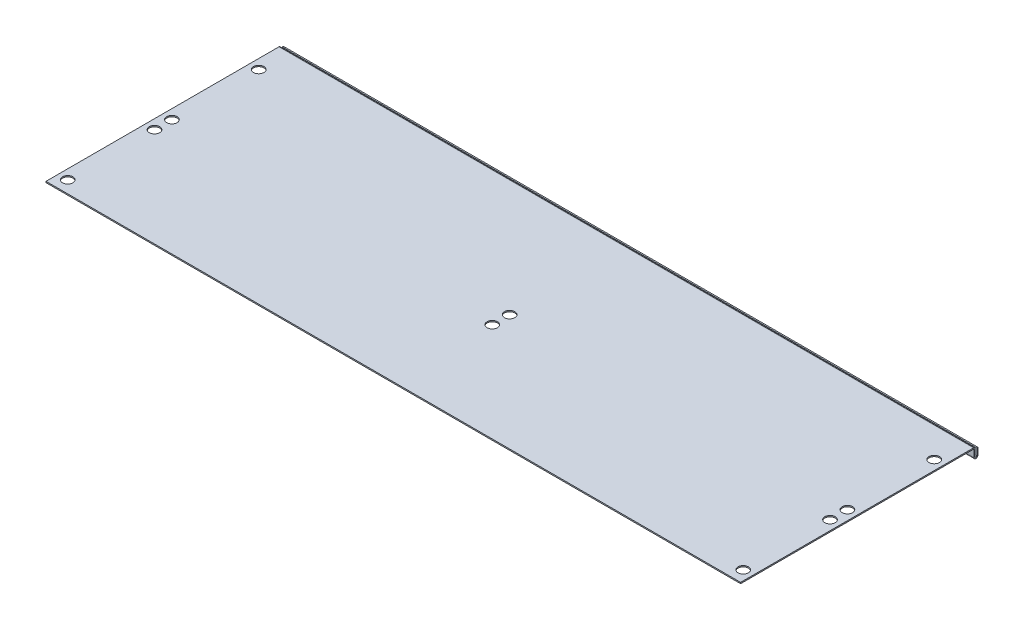
from build123d import *

# Parameters (mm, degrees)
SKETCH_1_W                       = 400
SKETCH_1_H                       = 135
SKETCH_1_R                       = 3
SM_BASE_FLANGE_1_DEPTH           = 0.7
SM_EDGE_FLANGE_1_STRIP_W         = 3.2
SM_EDGE_FLANGE_1_STRIP_H         = 0.7
SM_EDGE_FLANGE_1_STRIP_CUT_DEPTH = 400
SM_EDGE_FLANGE_1_DEPTH           = 400
OTHER_START                      = -200
OTHER_1_DEPTH                    = 400
OTHER_1_2_DEPTH                  = 400


# Read off the part's stored shape, not the designer's step: 褶边1
# Sheet-metal steps are written as plain solids
with BuildPart() as part:
    # Sketch 1 → 基体-法兰1 (new body)
    with BuildSketch(Plane(origin=(0, 0, 0), x_dir=(1, 0, 0), z_dir=(0, 1, 0))):
        Rectangle(SKETCH_1_W, SKETCH_1_H)
        with Locations(Location((-194.5, -60.5, 0), (0, 0, 270))):
            Circle(SKETCH_1_R, mode=Mode.SUBTRACT)
        with Locations(Location((-194.5, -10.5, 0), (0, 0, 270))):
            Circle(SKETCH_1_R, mode=Mode.SUBTRACT)
        with Locations(Location((-194.5, -0.5, 0), (0, 0, 270))):
            Circle(SKETCH_1_R, mode=Mode.SUBTRACT)
        with Locations(Location((-194.5, 49.5, 0), (0, 0, 270))):
            Circle(SKETCH_1_R, mode=Mode.SUBTRACT)
        with Locations(Location((0, -10.5, 0), (0, 0, 270))):
            Circle(SKETCH_1_R, mode=Mode.SUBTRACT)
        with Locations(Location((0, -0.5, 0), (0, 0, 270))):
            Circle(SKETCH_1_R, mode=Mode.SUBTRACT)
        with Locations(Location((194.5, -60.5, 0), (0, 0, 90))):
            Circle(SKETCH_1_R, mode=Mode.SUBTRACT)
        with Locations(Location((194.5, -10.5, 0), (0, 0, 90))):
            Circle(SKETCH_1_R, mode=Mode.SUBTRACT)
        with Locations(Location((194.5, -0.5, 0), (0, 0, 90))):
            Circle(SKETCH_1_R, mode=Mode.SUBTRACT)
        with Locations(Location((194.5, 49.5, 0), (0, 0, 90))):
            Circle(SKETCH_1_R, mode=Mode.SUBTRACT)
    extrude(amount=-SM_BASE_FLANGE_1_DEPTH)

    # 边线-法兰1 strip (across the edge) → 边线-法兰1 strip cut (cut)
    with BuildSketch(Plane(origin=(-200, -0.7, -67.5), x_dir=(0, 0, 1), z_dir=(1, 0, 0))):
        with Locations((-0.7, -0.35)):
            Rectangle(SM_EDGE_FLANGE_1_STRIP_W, SM_EDGE_FLANGE_1_STRIP_H)
    extrude(amount=SM_EDGE_FLANGE_1_STRIP_CUT_DEPTH, mode=Mode.SUBTRACT)

    # 边线-法兰1 section (across the edge) → 边线-法兰1 (add)
    with BuildSketch(Plane(origin=(-200, -0.7, -67.5), x_dir=(0, 0, 1), z_dir=(1, 0, 0))):
        with BuildLine():
            Line((0, 0.2), (0, 5.3))
            Line((0, 5.3), (0.7, 5.3))
            Line((0.7, 5.3), (0.7, 0.2))
            ThreePointArc((0.7, 0.2), (0.758578644, 0.058578644), (0.9, 0))
            Line((0.9, 0), (0.9, -0.7))
            ThreePointArc((0.9, -0.7), (0.263603897, -0.436396103), (0, 0.2))
        make_face()
    extrude(amount=SM_EDGE_FLANGE_1_DEPTH)

    # Other 1 outline → Other 1 (cut)
    with BuildSketch(Plane.YZ.offset(OTHER_START)):
        with BuildLine():
            Line((-6, -67.5), (-5.890871211, -67.5))
            ThreePointArc((-5.890871211, -67.5), (-5.44807407, -66.990049506), (-4.8, -66.8))
            Line((-4.8, -66.8), (-6, -66.8))
            Line((-6, -66.8), (-6, -67.5))
        make_face()
    extrude(amount=OTHER_1_DEPTH, mode=Mode.SUBTRACT)

    # Other 1 2 outline → Other 1 2 (add)
    with BuildSketch(Plane.YZ.offset(OTHER_START)):
        with BuildLine():
            Line((-1, -69.2), (-1, -68.5))
            Line((-1, -68.5), (-4.8, -68.5))
            ThreePointArc((-4.8, -68.5), (-5.3, -68), (-4.8, -67.5))
            Line((-4.8, -67.5), (-5.890871211, -67.5))
            ThreePointArc((-5.890871211, -67.5), (-5.809950494, -68.64807407), (-4.8, -69.2))
            Line((-4.8, -69.2), (-1, -69.2))
        make_face()
    extrude(amount=OTHER_1_2_DEPTH)


solid = part.part
